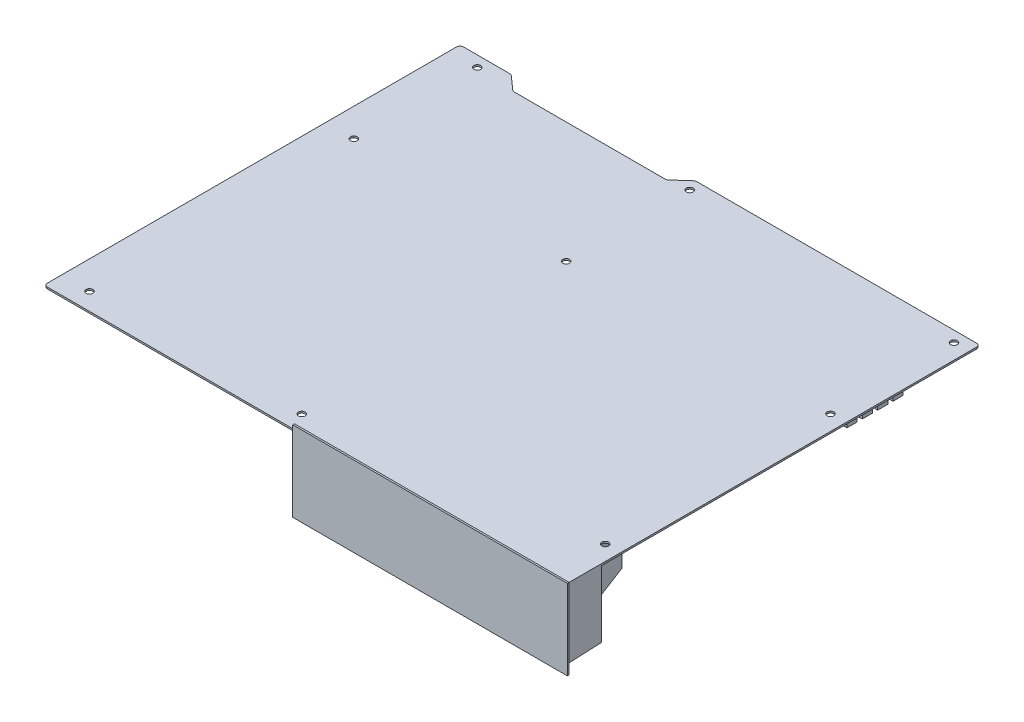
from build123d import *

# Parameters (mm, degrees)
SKETCH1_R           = 1.9812
BOSS_EXTRUDE1_DEPTH = 1
FILLET1_R           = 2
FILLET2_R           = 2
BOSS_EXTRUDE2_DEPTH = 40
SKETCH3_W           = 161
SKETCH3_H           = 47
BOSS_EXTRUDE3_DEPTH = 1
CUT_EXTRUDE1_DEPTH  = 225
SKETCH5_W           = 140
SKETCH5_H           = 6
BOSS_EXTRUDE4_DEPTH = 5
SKETCH6_W           = 6
SKETCH6_H           = 6
BOSS_EXTRUDE5_DEPTH = 12
SKETCH7_W           = 135
SKETCH7_H           = 1.5
CUT_EXTRUDE2_DEPTH  = 15
LPATTERN2_COUNT     = 4
LPATTERN2_PITCH     = 9
SKETCH8_W           = 6
SKETCH8_H           = 89
SKETCH8_W_2         = 2
SKETCH8_H_2         = 85
BOSS_EXTRUDE6_DEPTH = 12
SKETCH9_W           = 35
SKETCH9_H           = 30
BOSS_EXTRUDE7_DEPTH = 10


with BuildPart() as part:
    # Sketch1 → Boss-Extrude1 (new body)
    with BuildSketch(Plane(origin=(0, 0, 0), x_dir=(1, 0, 0), z_dir=(0, 1, 0))):
        Polygon((-152.4, 121.92), (-152.4, -121.92), (152.4, -121.92), (152.4, 121.92), (-14.4, 121.92), (-23.4, 113.92), (-113.4, 113.92), (-122.4, 121.92), align=None)
        with Locations((-11.43, -111.76)):
            Circle(SKETCH1_R, mode=Mode.SUBTRACT)
        with Locations((143.51, -88.9)):
            Circle(SKETCH1_R, mode=Mode.SUBTRACT)
        with Locations((-135.89, 43.18)):
            Circle(SKETCH1_R, mode=Mode.SUBTRACT)
        with Locations((-11.43, 115.57)):
            Circle(SKETCH1_R, mode=Mode.SUBTRACT)
        with Locations((-135.89, 115.57)):
            Circle(SKETCH1_R, mode=Mode.SUBTRACT)
        with Locations((143.51, 115.57)):
            Circle(SKETCH1_R, mode=Mode.SUBTRACT)
        with Locations((-135.89, -111.76)):
            Circle(SKETCH1_R, mode=Mode.SUBTRACT)
        with Locations((143.51, 43.18)):
            Circle(SKETCH1_R, mode=Mode.SUBTRACT)
        with Locations((-11.43, 43.18)):
            Circle(SKETCH1_R, mode=Mode.SUBTRACT)
    extrude(amount=BOSS_EXTRUDE1_DEPTH)

    # Fillet1
    fillet1_edges = [part.edges().sort_by_distance(p)[0] for p in [
        (-14.4, 0.5, -121.92),
        (-23.4, 0.5, -113.92),
        (-122.4, 0.5, -121.92),
        (-113.4, 0.5, -113.92),
    ]]
    fillet(fillet1_edges, radius=FILLET1_R)

    # Fillet2
    fillet2_edges = [part.edges().sort_by_distance(p)[0] for p in [
        (-152.4, 0.5, 121.92),
        (152.4, 0.5, -121.92),
        (-152.4, 0.5, -121.92),
    ]]
    fillet(fillet2_edges, radius=FILLET2_R)

    # Sketch2 → Boss-Extrude2 (add)
    with BuildSketch(Plane.XZ):
        Polygon((-2.6, 121.92), (152.4, 121.92), (152.4, 99.92), (134.319980014, 91.369393161), (122.529319933, 57.92), (24.529319933, 57.92), (-2.6, 99.92), align=None)
    extrude(amount=BOSS_EXTRUDE2_DEPTH)

    # Sketch3 → Boss-Extrude3 (add)
    with BuildSketch(Plane.XY.offset(121.92)):
        with Locations((74.9, -19.5)):
            Rectangle(SKETCH3_W, SKETCH3_H)
    extrude(amount=BOSS_EXTRUDE3_DEPTH)

    # Sketch4 → Cut-Extrude1 (cut, symmetric)
    with BuildSketch(Plane(origin=(0, 0, 0), x_dir=(0, 0, -1), z_dir=(1, 0, 0))):
        Polygon((-55.675354563, -37), (-121.92, -40), (-121.92, -43.768992378), (-55.675354563, -43.768992378), align=None)
    extrude(amount=CUT_EXTRUDE1_DEPTH, both=True, mode=Mode.SUBTRACT)

    # Sketch5 → Boss-Extrude4 (add)
    with BuildSketch(Plane.XZ):
        with Locations((67.4, -88.92)):
            Rectangle(SKETCH5_W, SKETCH5_H)
    boss_extrude4 = extrude(amount=BOSS_EXTRUDE4_DEPTH)

    # Sketch6 → Boss-Extrude5 (add)
    with BuildSketch(Plane.XZ.offset(5)):
        with Locations((134.4, -88.92)):
            Rectangle(SKETCH6_W, SKETCH6_H)
        with Locations((0.4, -88.92)):
            Rectangle(SKETCH6_W, SKETCH6_H)
    boss_extrude5 = extrude(amount=BOSS_EXTRUDE5_DEPTH)

    # Sketch7 → Cut-Extrude2 (cut)
    with BuildSketch(Plane.XZ.offset(17)):
        with Locations((67.4, -88.92)):
            Rectangle(SKETCH7_W, SKETCH7_H)
    cut_extrude2 = extrude(amount=-CUT_EXTRUDE2_DEPTH, mode=Mode.SUBTRACT)

    # LPattern2: Boss-Extrude4, Boss-Extrude5, Cut-Extrude2 ×4
    with Locations(*[(0, 0, i * LPATTERN2_PITCH) for i in range(1, LPATTERN2_COUNT)]):
        add(boss_extrude4)
        add(boss_extrude5)
        add(cut_extrude2, mode=Mode.SUBTRACT)

    # Sketch8 → Boss-Extrude6 (add)
    with BuildSketch(Plane.XZ):
        with Locations((-32.4, 34.42)):
            Rectangle(SKETCH8_W, SKETCH8_H)
        with Locations((-32.4, 34.42)):
            Rectangle(SKETCH8_W_2, SKETCH8_H_2, mode=Mode.SUBTRACT)
    extrude(amount=BOSS_EXTRUDE6_DEPTH)

    # Sketch9 → Boss-Extrude7 (add)
    with BuildSketch(Plane.XZ):
        with Locations((54.9, -1.92)):
            Rectangle(SKETCH9_W, SKETCH9_H)
    extrude(amount=BOSS_EXTRUDE7_DEPTH)


solid = part.part
